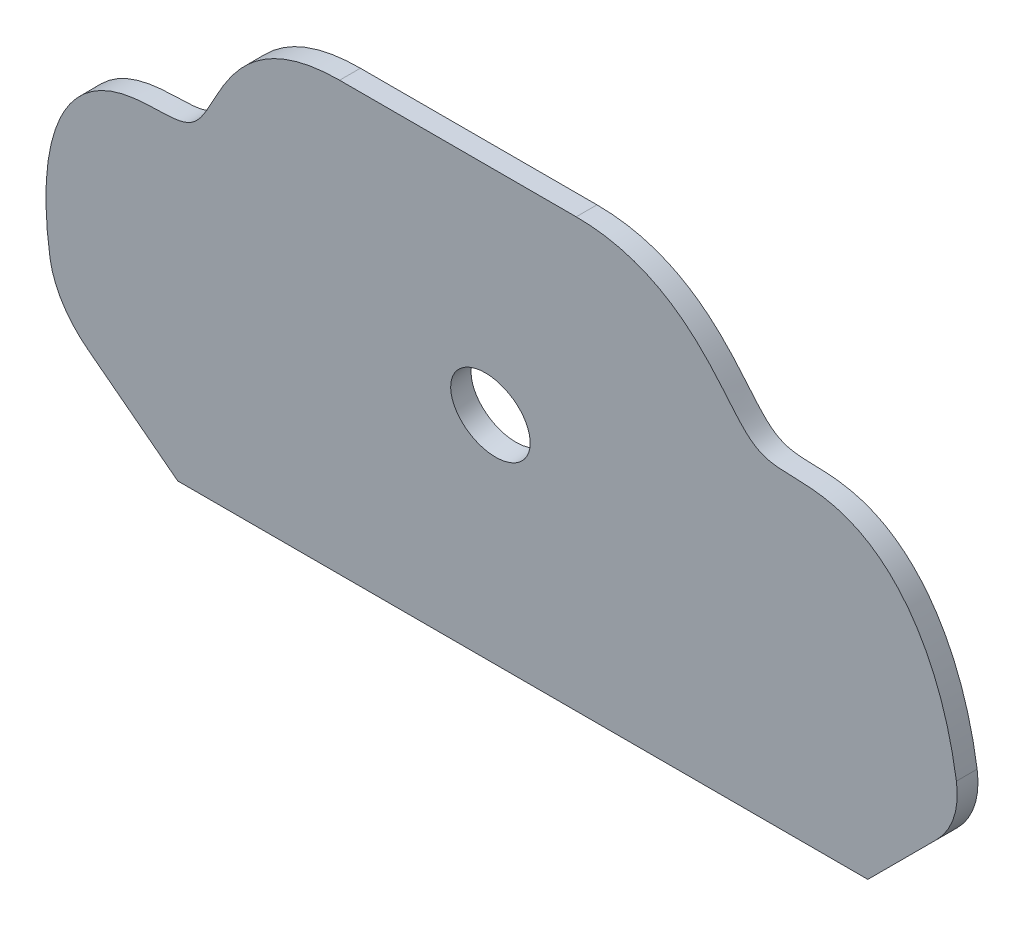
from build123d import *

# Parameters (mm, degrees)
BOSS_EXTRUDE1_START     = -25
BOSS_EXTRUDE1_DEPTH     = 50
CUT_EXTRUDE1_DEPTH      = 341.53226913
CUT_EXTRUDE1_DEPTH_BACK = 341.53226913
CUT_EXTRUDE2_DEPTH      = 341.286795308
CUT_EXTRUDE2_DEPTH_BACK = 341.286795308
SKETCH4_R               = 20


# Read off the part's stored shape, not the designer's step: Boss-Extrude1
with BuildPart() as part:
    # Boss-Extrude1 outline → Boss-Extrude1 (new body)
    with BuildSketch(Plane.XY.offset(BOSS_EXTRUDE1_START)):
        with BuildLine():
            Line((175, 0), (215.218833807, 40.218833807))
            ThreePointArc((215.218833807, 40.218833807), (226.057471223, 56.440000887), (229.863494748, 75.574172084))
            add(Edge.make_bspline(
                [(229.863494748, 75.574172084), (229.863497015, 220.574172084), (130.657195822, 208), (130.657198498, 108), (160, 250), (60, 250)],
                knots=[0, 0, 0, 0, 0, 0, 1, 1, 1, 1, 1, 1], degree=5))
            Line((60, 250), (-60, 250))
            add(Edge.make_bspline(
                [(-60, 250), (-160, 250), (-130.657198498, 108), (-130.657195822, 208), (-229.863497015, 220.574172084), (-229.863494748, 75.574172084)],
                knots=[0, 0, 0, 0, 0, 0, 1, 1, 1, 1, 1, 1], degree=5))
            ThreePointArc((-229.863494748, 75.574172084), (-226.057471223, 56.440000887), (-215.218833807, 40.218833807))
            Line((-215.218833807, 40.218833807), (-175, 0))
            Line((-175, 0), (175, 0))
        make_face()
    extrude(amount=BOSS_EXTRUDE1_DEPTH)

    # Sketch2 → Cut-Extrude1 (cut, two sides: drawn at the far end of the back side and taken through both)
    with BuildSketch(Plane(origin=(0, 0, 0), x_dir=(0, 0, -1), z_dir=(1, 0, 0)).offset(-CUT_EXTRUDE1_DEPTH_BACK)):
        Polygon((23.039732542, -10), (-12.506441807, 260), (35, 260), (35, -10), align=None)
        Polygon((-23.039732542, 260), (12.506441807, -10), (-35, -10), (-35, 260), align=None)
    extrude(amount=CUT_EXTRUDE1_DEPTH + CUT_EXTRUDE1_DEPTH_BACK, mode=Mode.SUBTRACT)

    # Sketch4 → Cut-Extrude2 (cut, two sides: drawn at the far end of the back side and taken through both)
    with BuildSketch(Plane(origin=(0, 2.811189919, -21.353107392), x_dir=(-1, 0, 0), z_dir=(0, 0.13052619222005532, -0.99144486137381)).offset(-CUT_EXTRUDE2_DEPTH_BACK)):
        with Locations(Location((0, 124.321792579, 0), (0, 0, 90))):
            Circle(SKETCH4_R)
    extrude(amount=CUT_EXTRUDE2_DEPTH + CUT_EXTRUDE2_DEPTH_BACK, mode=Mode.SUBTRACT)


solid = part.part
